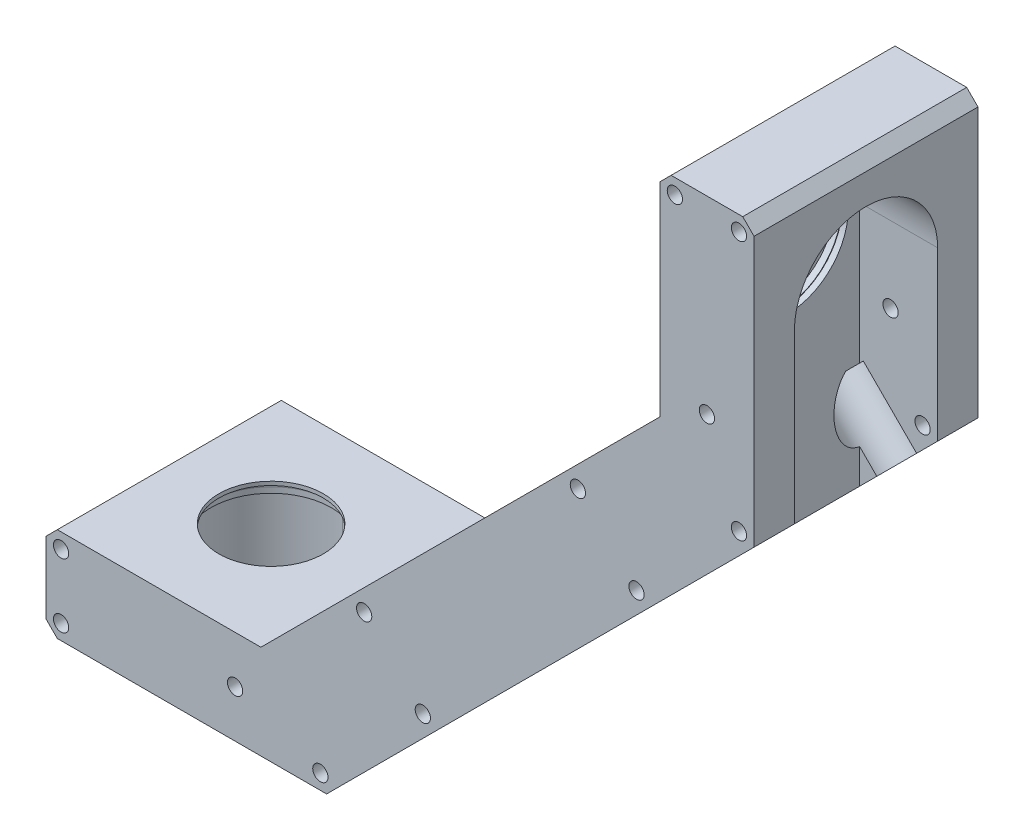
from build123d import *

# Parameters (mm, degrees)
SKETCH6_R           = 2.025
BOSS_EXTRUDE4_DEPTH = 29.7
CUT_EXTRUDE1_DEPTH  = 120.903689597
SKETCH10_R          = 2
CUT_EXTRUDE2_DEPTH  = 159.234351517
SKETCH11_R          = 7.5
CUT_EXTRUDE3_DEPTH  = 20


with BuildPart() as part:
    # Sketch6 → Boss-Extrude4 (new, symmetric)
    with BuildSketch(Plane.XY):
        Polygon((-27, -132.8), (27, -132.8), (79.9, -79.9), (101.113203436, -101.113203436), (44.426406871, -157.8), (-27, -157.8), (-30, -154.8), (-30, -135.8), align=None)
        with Locations((-26, -153.8)):
            Circle(SKETCH6_R, mode=Mode.SUBTRACT)
        with Locations((42.769552622, -153.8)):
            Circle(SKETCH6_R, mode=Mode.SUBTRACT)
        with Locations((-26, -136.8)):
            Circle(SKETCH6_R, mode=Mode.SUBTRACT)
        with Locations((20.156854249, -145.3)):
            Circle(SKETCH6_R, mode=Mode.SUBTRACT)
        with Locations((69.941378029, -126.628174593)):
            Circle(SKETCH6_R, mode=Mode.SUBTRACT)
        with Locations((54.385028843, -111.071825407)):
            Circle(SKETCH6_R, mode=Mode.SUBTRACT)
    boss_extrude4 = extrude(amount=BOSS_EXTRUDE4_DEPTH, both=True)

    # Sketch7 → Cut-Revolve1 (revolve, cut)
    with BuildSketch(Plane.XY):
        Polygon((-13.85, -133.8), (-13.85, -132.8), (0, -132.8), (0, -157.8), (-19, -157.8), (-19, -137.092), (-16, -137.092), (-16, -135.492), (-15.85, -135.492), (-15.85, -133.8), align=None)
    cut_revolve1 = revolve(axis=Axis((0, -176.448869965, 0), (0, 1, 0)), mode=Mode.SUBTRACT)

    # Sketch8 → Cut-Extrude1 (cut, through all)
    with BuildSketch(Plane.XZ.offset(137.092)):
        with BuildLine():
            ThreePointArc((19, 0), (13.435028843, -13.435028843), (0, -19))
            Line((0, -19), (100, -19))
            Line((100, -19), (100, 19))
            Line((100, 19), (0, 19))
            ThreePointArc((0, 19), (13.435028843, 13.435028843), (19, 0))
        make_face()
    cut_extrude1 = extrude(amount=CUT_EXTRUDE1_DEPTH, mode=Mode.SUBTRACT)

    # Mirror1: Boss-Extrude4, Cut-Revolve1, Cut-Extrude1 across plane
    add(boss_extrude4.mirror(Plane(origin=(0, 0, 0), x_dir=(0, 0, 1), z_dir=(0.7071067811865476, 0.7071067811865476, 0))))
    add(cut_revolve1.mirror(Plane(origin=(0, 0, 0), x_dir=(0, 0, 1), z_dir=(0.7071067811865476, 0.7071067811865476, 0))), mode=Mode.SUBTRACT)
    add(cut_extrude1.mirror(Plane(origin=(0, 0, 0), x_dir=(0, 0, 1), z_dir=(0.7071067811865476, 0.7071067811865476, 0))), mode=Mode.SUBTRACT)

    # Sketch10 → Cut-Extrude2 (cut, through all)
    with BuildSketch(Plane(origin=(79.9, -79.9, 0), x_dir=(0, 0, 1), z_dir=(-0.7071067811865477, 0.7071067811865474, 0))):
        with Locations((-19.7, -64.81189745)):
            Circle(SKETCH10_R)
        with Locations((19.7, -64.81189745)):
            Circle(SKETCH10_R)
        with Locations((-19.7, 64.81189745)):
            Circle(SKETCH10_R)
        with Locations((19.7, 64.81189745)):
            Circle(SKETCH10_R)
    extrude(amount=-CUT_EXTRUDE2_DEPTH, mode=Mode.SUBTRACT)

    # Sketch11 → Cut-Extrude3 (cut)
    with BuildSketch(Plane(origin=(101.113203436, -101.113203436, 0), x_dir=(0, 0, -1), z_dir=(0.7071067811865477, -0.7071067811865474, 0))):
        with Locations((19.7, -64.81189745)):
            Circle(SKETCH11_R)
        with Locations((-19.7, -64.81189745)):
            Circle(SKETCH11_R)
        with Locations((-19.7, 64.81189745)):
            Circle(SKETCH11_R)
        with Locations((19.7, 64.81189745)):
            Circle(SKETCH11_R)
    extrude(amount=-CUT_EXTRUDE3_DEPTH, mode=Mode.SUBTRACT)


solid = part.part
